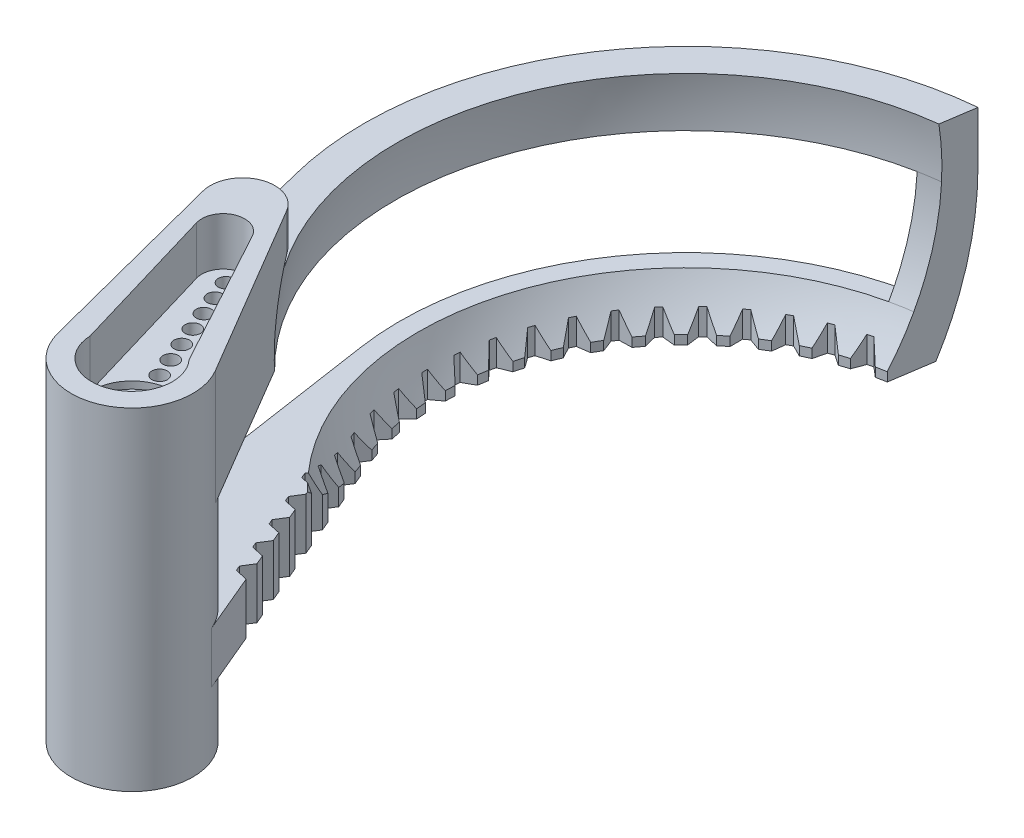
from build123d import *

# Parameters (mm, degrees)
BOSS_EXTRUDE2_START        = 1.55
BOSS_EXTRUDE2_OUTLINE_R    = 0.75
BOSS_EXTRUDE2_OUTLINE_R_2  = 2.5
BOSS_EXTRUDE2_DEPTH        = 5
BOSS_EXTRUDE6_START        = 0.85
SKETCH10_R                 = 0.7500000000000009
SKETCH10_R_2               = 0.75
SKETCH10_R_3               = 2.5
BOSS_EXTRUDE6_DEPTH        = 0.85
BOSS_EXTRUDE10_START       = 0.85
BOSS_EXTRUDE10_OUTLINE_R   = 0.75
BOSS_EXTRUDE10_OUTLINE_R_2 = 3.95
BOSS_EXTRUDE10_DEPTH       = 0.7
BOSS_EXTRUDE7_START        = 1.55
BOSS_EXTRUDE7_DEPTH        = 4.7
SKETCH8_R                  = 5.950000000009102
SKETCH8_R_2                = 4.2000000000091
BOSS_EXTRUDE4_DEPTH        = 10
SKETCH9_R                  = 4.2000000000091
BOSS_EXTRUDE5_DEPTH        = 5
BOSS_EXTRUDE8_START        = 15
SKETCH8_2_R                = 5.950000000009102
SKETCH8_2_R_2              = 4.2000000000091
BOSS_EXTRUDE8_DEPTH        = 6.25
REVOLVE3_ANGLE             = 107.69851
CUT_EXTRUDE1_DEPTH         = 15
CUT_EXTRUDE2_REACH         = 95.148
CUT_EXTRUDE3_DEPTH         = 10
CUT_EXTRUDE4_DEPTH         = 92.86449042295817
CIRPATTERN1_COUNT          = 15
CIRPATTERN1_ANGLE          = 98.00000000000023
CUT_EXTRUDE6_DEPTH         = 92.86449042295817
LPATTERN2_COUNT            = 7
LPATTERN2_PITCH            = 3


# Read off the part's stored shape, not the designer's step: Boss-Extrude2, Boss-Extrude10, Revolve3
with BuildPart() as part:
    # Boss-Extrude2 outline → Boss-Extrude2 (new body)
    with BuildSketch(Plane.XZ.offset(-24.000000000001936).offset(BOSS_EXTRUDE2_START)):
        with BuildLine():
            ThreePointArc((-11.120166198, -17.936385501), (-13.964271163, -9.415152175), (-22.004400319, -13.422230114))
            Line((-22.004400319, -13.422230114), (-30.049882171, -44.549281802))
            ThreePointArc((-30.049882171, -44.549281802), (-25.298563604, -70.580725163), (-2.378519162, -83.80504497))
            Line((-2.378519162, -83.80504497), (-2.998966251, -79.71523595))
            ThreePointArc((-2.998966251, -79.71523595), (-24.243674565, -64.539081778), (-23.23244448, -38.45018183))
            Line((-23.23244448, -38.45018183), (-11.120166198, -17.936385501))
        make_face()
        with Locations((-22.756427447, -30.614220265)):
            Circle(BOSS_EXTRUDE2_OUTLINE_R, mode=Mode.SUBTRACT)
        with Locations((-21.990226464, -28.766806924)):
            Circle(BOSS_EXTRUDE2_OUTLINE_R, mode=Mode.SUBTRACT)
        with Locations((-21.22402548, -26.919393583)):
            Circle(BOSS_EXTRUDE2_OUTLINE_R, mode=Mode.SUBTRACT)
        with Locations((-20.457824497, -25.071980242)):
            Circle(BOSS_EXTRUDE2_OUTLINE_R, mode=Mode.SUBTRACT)
        with Locations((-19.691623514, -23.2245669)):
            Circle(BOSS_EXTRUDE2_OUTLINE_R, mode=Mode.SUBTRACT)
        with Locations((-18.92542253, -21.377153559)):
            Circle(BOSS_EXTRUDE2_OUTLINE_R, mode=Mode.SUBTRACT)
        with Locations((-18.159221547, -19.529740218)):
            Circle(BOSS_EXTRUDE2_OUTLINE_R, mode=Mode.SUBTRACT)
        with Locations((-16.243719088, -14.911206865)):
            Circle(BOSS_EXTRUDE2_OUTLINE_R_2, mode=Mode.SUBTRACT)
    extrude(amount=BOSS_EXTRUDE2_DEPTH)

    # Sketch10 → Boss-Extrude6 (add)
    with BuildSketch(Plane(origin=(-2.071e-14, 22.450000000001946, 3.533e-14), x_dir=(1, 9.2e-16, 0), z_dir=(-9.2e-16, 1, 1.54e-15)).offset(BOSS_EXTRUDE6_START)):
        with BuildLine():
            ThreePointArc((-21.189039781873603, 34.98939709502554), (-25.114372915184564, 36.2995430593753), (-26.960246065177294, 32.59583208664718))
            Line((-26.960246065177294, 32.59583208664718), (-22.004400318537552, 13.422230114080058))
            ThreePointArc((-22.004400318537556, 13.422230114080056), (-13.964271162964012, 9.415152175215642), (-11.120166198081936, 17.93638550115918))
            Line((-11.120166198081938, 17.936385501159183), (-21.189039781873603, 34.98939709502554))
        make_face()
        with Locations((-21.990226464, 28.766806924)):
            Circle(SKETCH10_R, mode=Mode.SUBTRACT)
        with Locations((-20.457824497, 25.071980242)):
            Circle(SKETCH10_R_2, mode=Mode.SUBTRACT)
        with Locations((-21.22402548, 26.919393583)):
            Circle(SKETCH10_R_2, mode=Mode.SUBTRACT)
        with Locations((-18.92542253, 21.377153559)):
            Circle(SKETCH10_R_2, mode=Mode.SUBTRACT)
        with Locations((-18.159221547, 19.529740218)):
            Circle(SKETCH10_R_2, mode=Mode.SUBTRACT)
        with Locations((-19.691623514, 23.2245669)):
            Circle(SKETCH10_R_2, mode=Mode.SUBTRACT)
        with Locations((-16.243719088, 14.911206865)):
            Circle(SKETCH10_R_3, mode=Mode.SUBTRACT)
        with Locations((-22.756427447, 30.614220265)):
            Circle(SKETCH10_R_2, mode=Mode.SUBTRACT)
    extrude(amount=-BOSS_EXTRUDE6_DEPTH)

    # Boss-Extrude10 outline → Boss-Extrude10 (add)
    with BuildSketch(Plane(origin=(-2.071e-14, 22.450000000001946, 3.533e-14), x_dir=(1, 9.2e-16, 0), z_dir=(-9.2e-16, 1, 1.54e-15)).offset(BOSS_EXTRUDE10_START)):
        with BuildLine():
            ThreePointArc((-21.189039782, 34.989397095), (-25.114372915, 36.299543059), (-26.960246065, 32.595832087))
            Line((-26.960246065, 32.595832087), (-22.004400319, 13.422230114))
            ThreePointArc((-22.004400319, 13.422230114), (-13.964271163, 9.415152175), (-11.120166198, 17.936385501))
            Line((-11.120166198, 17.936385501), (-21.189039782, 34.989397095))
        make_face()
        with Locations((-18.92542253, 21.377153559)):
            Circle(BOSS_EXTRUDE10_OUTLINE_R, mode=Mode.SUBTRACT)
        with Locations((-16.243719088, 14.911206865)):
            Circle(BOSS_EXTRUDE10_OUTLINE_R_2, mode=Mode.SUBTRACT)
        with Locations((-18.159221547, 19.529740218)):
            Circle(BOSS_EXTRUDE10_OUTLINE_R, mode=Mode.SUBTRACT)
        with Locations((-19.691623514, 23.2245669)):
            Circle(BOSS_EXTRUDE10_OUTLINE_R, mode=Mode.SUBTRACT)
        with Locations((-20.457824497, 25.071980242)):
            Circle(BOSS_EXTRUDE10_OUTLINE_R, mode=Mode.SUBTRACT)
        with Locations((-21.22402548, 26.919393583)):
            Circle(BOSS_EXTRUDE10_OUTLINE_R, mode=Mode.SUBTRACT)
        with Locations((-21.990226464, 28.766806924)):
            Circle(BOSS_EXTRUDE10_OUTLINE_R, mode=Mode.SUBTRACT)
        with Locations((-22.756427447, 30.614220265)):
            Circle(BOSS_EXTRUDE10_OUTLINE_R, mode=Mode.SUBTRACT)
    extrude(amount=BOSS_EXTRUDE10_DEPTH)

    # Sketch10<3> → Boss-Extrude7 (add)
    with BuildSketch(Plane(origin=(-2.071e-14, 22.450000000001946, 3.533e-14), x_dir=(1, 9.2e-16, 0), z_dir=(-9.2e-16, 1, 1.54e-15)).offset(BOSS_EXTRUDE7_START)):
        with BuildLine():
            ThreePointArc((-21.189039781873603, 34.98939709502554), (-25.114372915184564, 36.2995430593753), (-26.960246065177294, 32.59583208664718))
            Line((-26.960246065177294, 32.59583208664718), (-22.004400318537552, 13.422230114080058))
            ThreePointArc((-22.004400318537556, 13.422230114080056), (-13.964271162964012, 9.415152175215642), (-11.120166198081936, 17.93638550115918))
            Line((-11.120166198081938, 17.936385501159183), (-21.189039781873603, 34.98939709502554))
        make_face()
        with BuildLine():
            Line((-20.720096676570666, 31.155753603078956), (-13.342668649024056, 17.59195421394013))
            ThreePointArc((-13.342668649020382, 17.591954213943524), (-12.565292166801132, 16.350538439948274), (-12.29371908844302, 14.911206865173751))
            ThreePointArc((-12.29371908844302, 14.91120686517375), (-16.164032102960814, 10.962010746419548), (-20.190503890652447, 14.751865329072084))
            Line((-20.190503890647886, 14.751865329072269), (-24.5782975180459, 29.55559341539554))
            ThreePointArc((-24.578297518049087, 29.555593415394593), (-23.369388233660036, 32.09215093798645), (-20.720096676567746, 31.155753603080544))
        make_face(mode=Mode.SUBTRACT)
    extrude(amount=BOSS_EXTRUDE7_DEPTH)

    # Sketch8 → Boss-Extrude4 (add)
    with BuildSketch(Plane.XZ.offset(-17.450000000001946)):
        with Locations(Location((-16.243719088448373, -14.91120686517412, 0), (0, 0, 270))):
            Circle(SKETCH8_R)
        with Locations(Location((-16.243719088448373, -14.91120686517412, 0), (0, 0, 270))):
            Circle(SKETCH8_R_2, mode=Mode.SUBTRACT)
    extrude(amount=BOSS_EXTRUDE4_DEPTH)

    # Sketch9 → Boss-Extrude5 (add)
    with BuildSketch(Plane.XZ.offset(-7.450000000001951)):
        with BuildLine():
            Line((-21.66934438738931, -43.11383467031033), (-10.760499966070991, -17.22136011898724))
            ThreePointArc((-10.760499966070991, -17.22136011898724), (-14.636672821862426, -9.182341157447985), (-22.128469036074666, -14.03244748171317))
            Line((-22.128469036074673, -14.03244748171317), (-27.24509894141088, -48.29676162065673))
            ThreePointArc((-27.245098941410877, -48.29676162065673), (-21.825948096336784, -69.39907591549574), (-2.921072391572434, -80.22868990064057))
            Line((-2.9210723915724355, -80.22868990064057), (-3.5478507948188818, -76.09714667747896))
            ThreePointArc((-3.5478507948188778, -76.09714667747895), (-20.58654253388517, -63.98868536735252), (-21.669344387389316, -43.113834670310325))
        make_face()
        with Locations((-16.243719088448373, -14.91120686517412)):
            Circle(SKETCH9_R, mode=Mode.SUBTRACT)
    extrude(amount=BOSS_EXTRUDE5_DEPTH)

    # Sketch8<2> → Boss-Extrude8 (add)
    with BuildSketch(Plane.XZ.offset(-17.450000000001946).offset(BOSS_EXTRUDE8_START)):
        with Locations(Location((-16.243719088448373, -14.91120686517412, 0), (0, 0, 270))):
            Circle(SKETCH8_2_R)
        with Locations(Location((-16.243719088448373, -14.91120686517412, 0), (0, 0, 270))):
            Circle(SKETCH8_2_R_2, mode=Mode.SUBTRACT)
    extrude(amount=BOSS_EXTRUDE8_DEPTH)

    # Sketch13 one side → Cut-Revolve1 (revolve, cut)
    with BuildSketch(Plane(origin=(9.0428730819818, 1.049e-14, -1.5268316622360112), x_dir=(0.1664871993071507, 0, 0.986043615904926), z_dir=(-0.986043615904926, -1.1439851035138657e-15, 0.1664871993071507))):
        with BuildLine():
            ThreePointArc((-51.625777412297936, -9.79999999999798), (-31.473234148480937, -1.452543263814782), (-23.12577741229734, 18.70000000000202))
            ThreePointArc((-23.12577741229734, 18.700000000002028), (-31.473234148480934, 38.85254326381883), (-51.62577741229791, 47.200000000002035))
            Line((-51.625777412297346, 47.200000000002035), (-51.625777412297346, -9.79999999999798))
        make_face()
    revolve(axis=Axis((0.44784198855399504, 47.20000000000201, -52.43209989576055), (1.24e-15, -1, 3.7e-16)), mode=Mode.SUBTRACT)

    # Revolve3 outline → Revolve3 (revolve)
    with BuildSketch(Plane(origin=(0.447841989, 0, -52.432099896), x_dir=(-0.08972575080243039, 0, -0.9959665103018978), z_dir=(0.9959665103018978, 0, -0.08972575080243039))):
        with BuildLine():
            Line((31.5, 17.45), (28.472574524, 17.45))
            ThreePointArc((28.472574524, 17.45), (27.779448973, 12.345444681), (26.175850078, 7.45))
            Line((26.175850078, 7.45), (28, 7.45))
            Line((28, 7.45), (27.999996516, 2.44999294))
            ThreePointArc((27.999996516, 2.44999294), (30.613402964, 9.748535266), (31.5, 17.45))
        make_face()
    revolve(axis=Axis((0.447841989, 0, -52.432099896), (0, 1, 0)), revolution_arc=REVOLVE3_ANGLE)

    # Sketch15 → Cut-Extrude1 (cut)
    with BuildSketch(Plane(origin=(-1.572e-14, 17.45000000000195, 2.54e-14), x_dir=(1, 9e-16, 0), z_dir=(-9e-16, 1, 1.46e-15))):
        with BuildLine():
            ThreePointArc((-2.847549982291387, 80.71332850695227), (-2.477465654189743, 80.75400087707368), (-2.1068811378524, 80.78983058330677))
            Line((-2.1068811378524, 80.78983058330677), (-2.378519161724061, 83.80504497027052))
            Line((-2.378519161724061, 83.80504497027052), (-2.847549982291387, 80.71332850695227))
        make_face()
        with BuildLine():
            ThreePointArc((-2.1068811378523993, 80.78983058330677), (-2.4774656541897473, 80.75400087707368), (-2.847549982291387, 80.71332850695227))
            Line((-2.847549982291235, 80.71332850695224), (-3.205821760917789, 78.35170383806275))
            ThreePointArc((-3.20582176091779, 78.35170383806276), (-2.5542591185427526, 78.43522502069082), (-1.90080581261175, 78.50236995239958))
            Line((-1.90080581261175, 78.50236995239958), (-2.1068811378524, 80.78983058330677))
        make_face()
    extrude(amount=-CUT_EXTRUDE1_DEPTH, mode=Mode.SUBTRACT)

    # Cut-Extrude2: up to this face of the body (flat: up to its plane)
    cut_extrude2_end = Plane(part.part.faces().sort_by_distance((-25.67442167, 17.45, -29.076924212))[0])
    # Sketch17 → Cut-Extrude2 (cut, up to the picked face)
    with BuildSketch(Plane.XZ.offset(-2.450000000001957), mode=Mode.PRIVATE) as cut_extrude2_sk1:
        with BuildLine():
            Line((-4.440008785012953, -83.55056571294651), (-4.994096999833948, -79.89817533523072))
            ThreePointArc((-4.994096999834389, -79.89817533523092), (-22.446314558278026, -68.55219902725466), (-27.245098941410888, -48.29676162065673))
            Line((-27.245098941410884, -48.29676162065673), (-26.186922726708705, -41.21051874092449))
            Line((-26.186922726708705, -41.21051874092449), (-28.580965129871437, -40.20187678735703))
            ThreePointArc((-28.580965129871437, -40.20187678735703), (-29.394694165049955, -42.3487950842954), (-30.049882170742503, -44.54928180173269))
            ThreePointArc((-30.049882170742507, -44.54928180173269), (-25.88293401621121, -69.72198812521282), (-4.4400087850129495, -83.5505657129465))
        make_face()
    cut_extrude2_tool1 = split(extrude(cut_extrude2_sk1.sketch, amount=-CUT_EXTRUDE2_REACH, mode=Mode.PRIVATE), bisect_by=cut_extrude2_end, keep=Keep.BOTH, mode=Mode.PRIVATE)
    add(cut_extrude2_tool1.solids().sort_by(Axis((-22.862217, 2.45, -68.845042), (-9e-16, 1, 1.54e-15)))[0], mode=Mode.SUBTRACT)

    # Sketch18 → Cut-Extrude3 (cut)
    with BuildSketch(Plane(origin=(-6.7e-15, 7.450000000001951, 1.143e-14), x_dir=(1, 9e-16, 0), z_dir=(-9e-16, 1, 1.54e-15))):
        with BuildLine():
            Line((-5.28628361175989, 77.97216510554105), (-4.994096999833595, 79.89817533523072))
            ThreePointArc((-4.9940969998335945, 79.89817533523072), (-22.446314558277894, 68.55219902725493), (-27.245098941410916, 48.29676162065671))
            Line((-27.245098941410916, 48.29676162065671), (-26.482129830146107, 43.18741937969808))
            ThreePointArc((-26.48212983014611, 43.18741937969808), (-26.151988021063495, 42.27648354521345), (-25.79104290063887, 41.37730818484475))
            Line((-25.791042900638868, 41.37730818484475), (-23.674497791855153, 42.26903683197183))
            ThreePointArc((-23.67449779185515, 42.26903683197183), (-22.822965332794475, 64.41728466416198), (-5.286283611759889, 77.97216510554105))
        make_face()
        with BuildLine():
            ThreePointArc((-25.79104290063887, 41.37730818484475), (-26.151988021063495, 42.27648354521345), (-26.48212983014611, 43.18741937969808))
            Line((-26.482129830146107, 43.18741937969808), (-26.186922726708698, 41.21051874092451))
            Line((-26.186922726708698, 41.21051874092451), (-25.791042900638868, 41.37730818484475))
        make_face()
    extrude(amount=CUT_EXTRUDE3_DEPTH, mode=Mode.SUBTRACT)

    # Sketch20 → Cut-Extrude4 (cut, through all)
    with BuildSketch(Plane(origin=(-6.7e-15, 7.450000000001951, 1.143e-14), x_dir=(1, 9e-16, 0), z_dir=(-9e-16, 1, 1.53e-15))):
        with BuildLine():
            Line((-5.752140321104498, 76.65110522958743), (-5.504141028718192, 75.68234501623436))
            ThreePointArc((-5.504141028718198, 75.6823450162344), (-5.0183633605149724, 75.8013232264967), (-4.530211919021254, 75.91015303679606))
            Line((-4.530211919021249, 75.91015303679603), (-5.474332259895694, 76.7205303137806))
            ThreePointArc((-5.474332259895693, 76.7205303137806), (-5.613335691187805, 76.68621552867137), (-5.752140321104497, 76.65110522958743))
        make_face()
        with BuildLine():
            ThreePointArc((-6.467732345727405, 75.41415445202344), (-5.987333968136169, 75.55327007389928), (-5.504141028718198, 75.6823450162344))
            Line((-5.504141028718192, 75.68234501623436), (-5.752140321104498, 76.65110522958743))
            ThreePointArc((-5.752140321104497, 76.65110522958743), (-5.890741596974081, 76.6152005681162), (-6.029134972794932, 76.57850272189944))
            Line((-6.029134972794931, 76.57850272189944), (-6.467732345727394, 75.41415445202341))
        make_face()
    cut_extrude4 = extrude(amount=-CUT_EXTRUDE4_DEPTH, mode=Mode.SUBTRACT)

    # CirPattern1: Cut-Extrude4 ×15 about axis
    cirpattern1_axis = Axis((0.4478419885532108, 0, -52.43209989576041), (0, 1, 0))
    for i in range(1, CIRPATTERN1_COUNT):
        add(cut_extrude4.rotate(cirpattern1_axis, i * CIRPATTERN1_ANGLE / (CIRPATTERN1_COUNT - 1)), mode=Mode.SUBTRACT)

    # Sketch21 → Cut-Extrude6 (cut, through all)
    with BuildSketch(Plane(origin=(-6.7e-15, 7.450000000001951, 1.143e-14), x_dir=(1, 9e-16, 0), z_dir=(-9e-16, 1, 1.53e-15))):
        with BuildLine():
            Line((-20.975655764076, 41.467343590963594), (-21.637614069010972, 40.41383243694889))
            ThreePointArc((-21.637614069010972, 40.41383243694889), (-21.52977130253452, 40.15378170864891), (-21.41900698683483, 39.894961867952276))
            Line((-21.41900698683483, 39.894961867952276), (-20.20272839583745, 39.63277693667819))
            Line((-20.20272839583745, 39.63277693667819), (-20.975655764076, 41.467343590963594))
        make_face()
    cut_extrude6 = extrude(amount=-CUT_EXTRUDE6_DEPTH, mode=Mode.SUBTRACT)

    # LPattern2: Cut-Extrude6 ×7
    with Locations(*[Vector(0.3882610510604342, -1.0646127210713572e-15, 0.9215494323309233) * (i * LPATTERN2_PITCH) for i in range(1, LPATTERN2_COUNT)]):
        add(cut_extrude6, mode=Mode.SUBTRACT)


solid = part.part
